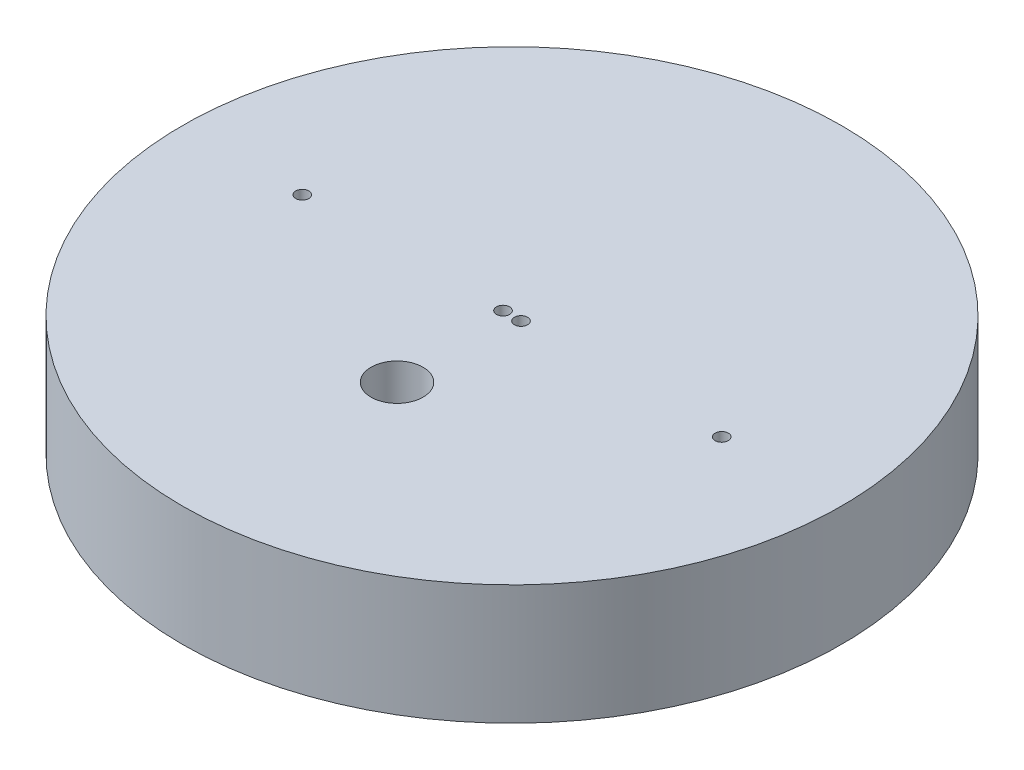
from build123d import *

# Parameters (mm, degrees)
SKETCH16_W           = 60
SKETCH16_H           = 60
BOSS_EXTRUDE7_DEPTH  = 10
REVOLVE3_ANGLE       = 180
SKETCH18_R           = 1.75
CUT_EXTRUDE1_DEPTH   = 20.5
SKETCH24_R           = 0.55
CUT_EXTRUDE3_DEPTH   = 47
SKETCH35_W           = 37.108936952
SKETCH35_H           = 20.335438399
CUT_EXTRUDE7_DEPTH   = 66
SKETCH40_R           = 15
CUT_EXTRUDE8_DEPTH   = 3
SKETCH41_R           = 15
CUT_EXTRUDE9_DEPTH   = 13
BOSS_EXTRUDE10_START = -10
SKETCH44_R           = 27.5
SKETCH44_R_2         = 25
BOSS_EXTRUDE10_DEPTH = 10
SKETCH45_W           = 60
SKETCH45_H           = 60
SKETCH45_R           = 27.5
CUT_EXTRUDE10_DEPTH  = 10
SKETCH46_R           = 2.5
BOSS_EXTRUDE11_DEPTH = 4
SKETCH47_R           = 2.170581875
CUT_EXTRUDE11_DEPTH  = 41.416580756
SKETCH48_R           = 0.55
CUT_EXTRUDE12_DEPTH  = 41.416580756
SKETCH49_R           = 27.5
CUT_EXTRUDE13_DEPTH  = 10


with BuildPart() as part:
    # Sketch16 → Boss-Extrude7 (new body)
    with BuildSketch(Plane(origin=(0, 57.950548418, 0), x_dir=(1, 0, 0), z_dir=(0, 1, 0))):
        Rectangle(SKETCH16_W, SKETCH16_H)
    extrude(amount=BOSS_EXTRUDE7_DEPTH)

    # Sketch17 → Revolve3 (revolve)
    with BuildSketch(Plane.XZ.offset(-57.950548418)):
        with BuildLine():
            Line((0, 15), (0, -15))
            ThreePointArc((0, -15), (15, 0), (0, 15))
        make_face()
    revolve(axis=Axis((0, 57.950548418, 15), (0, 0, -1)), revolution_arc=REVOLVE3_ANGLE)

    # Sketch18 → Cut-Extrude1 (cut, symmetric)
    with BuildSketch(Plane.XZ.offset(-57.950548418)):
        with Locations((-20, 20)):
            Circle(SKETCH18_R)
        with Locations((20, 20)):
            Circle(SKETCH18_R)
        with Locations((-20, -20)):
            Circle(SKETCH18_R)
        with Locations((20, -20)):
            Circle(SKETCH18_R)
    extrude(amount=CUT_EXTRUDE1_DEPTH, both=True, mode=Mode.SUBTRACT)

    # Sketch24 → Cut-Extrude3 (cut)
    with BuildSketch(Plane(origin=(0, 67.950548418, 0), x_dir=(1, 0, 0), z_dir=(0, 1, 0))):
        with Locations((-17.5, 0)):
            Circle(SKETCH24_R)
        with Locations((17.5, 0)):
            Circle(SKETCH24_R)
    extrude(amount=-CUT_EXTRUDE3_DEPTH, mode=Mode.SUBTRACT)

    # Sketch35 → Cut-Extrude7 (cut)
    with BuildSketch(Plane(origin=(0, 0, -30), x_dir=(-1, 0, 0), z_dir=(0, 0, -1))):
        with Locations((-0.194287628, 37.782829219)):
            Rectangle(SKETCH35_W, SKETCH35_H)
    extrude(amount=-CUT_EXTRUDE7_DEPTH, mode=Mode.SUBTRACT)

    # Sketch40 → Cut-Extrude8 (cut)
    with BuildSketch(Plane(origin=(0, 57.950548418, 0), x_dir=(-1, 0, 0), z_dir=(0, -1, 0))):
        with BuildLine():
            ThreePointArc((-24.875, -2.496873044), (-17.67766953, -17.67766953), (-2.496873044, -24.875))
            ThreePointArc((-2.496873044, -24.875), (0, -22.5), (2.496873044, -24.875))
            ThreePointArc((2.496873044, -24.875), (17.67766953, -17.67766953), (24.875, -2.496873044))
            ThreePointArc((24.875, -2.496873044), (22.5, 0), (24.875, 2.496873044))
            ThreePointArc((24.875, 2.496873044), (17.67766953, 17.67766953), (2.496873044, 24.875))
            ThreePointArc((2.496873044, 24.875), (0, 22.5), (-2.496873044, 24.875))
            ThreePointArc((-2.496873044, 24.875), (-17.67766953, 17.67766953), (-24.875, 2.496873044))
            ThreePointArc((-24.875, 2.496873044), (-22.5, 0), (-24.875, -2.496873044))
        make_face()
        Circle(SKETCH40_R, mode=Mode.SUBTRACT)
    extrude(amount=-CUT_EXTRUDE8_DEPTH, mode=Mode.SUBTRACT)

    # Sketch41 → Cut-Extrude9 (cut)
    with BuildSketch(Plane.XZ.offset(-47.950548418)):
        Circle(SKETCH41_R)
    extrude(amount=-CUT_EXTRUDE9_DEPTH, mode=Mode.SUBTRACT)

    # Sketch44 → Boss-Extrude10 (add)
    with BuildSketch(Plane(origin=(0, 67.950548418, 0), x_dir=(1, 0, 0), z_dir=(0, 1, 0)).offset(BOSS_EXTRUDE10_START)):
        Circle(SKETCH44_R)
        Circle(SKETCH44_R_2, mode=Mode.SUBTRACT)
    extrude(amount=BOSS_EXTRUDE10_DEPTH)

    # Sketch45 → Cut-Extrude10 (cut)
    with BuildSketch(Plane(origin=(0, 57.950548418, 0), x_dir=(-1, 0, 0), z_dir=(0, -1, 0))):
        Rectangle(SKETCH45_W, SKETCH45_H)
        Circle(SKETCH45_R, mode=Mode.SUBTRACT)
    extrude(amount=-CUT_EXTRUDE10_DEPTH, mode=Mode.SUBTRACT)

    # Sketch46 → Boss-Extrude11 (add)
    with BuildSketch(Plane(origin=(0, 67.950548418, 0), x_dir=(1, 0, 0), z_dir=(0, 1, 0))):
        with Locations((0, 25)):
            Circle(SKETCH46_R)
        with Locations((-25, 0)):
            Circle(SKETCH46_R)
        with Locations((25, 0)):
            Circle(SKETCH46_R)
        with Locations((0, -25)):
            Circle(SKETCH46_R)
    extrude(amount=BOSS_EXTRUDE11_DEPTH)

    # Sketch47 → Cut-Extrude11 (cut, through all)
    with BuildSketch(Plane(origin=(0, 60.950548418, 0), x_dir=(-1, 0, 0), z_dir=(0, -1, 0))):
        with Locations((0, -9.593971887)):
            Circle(SKETCH47_R)
    extrude(amount=-CUT_EXTRUDE11_DEPTH, mode=Mode.SUBTRACT)

    # Sketch48 → Cut-Extrude12 (cut, through all)
    with BuildSketch(Plane(origin=(0, 60.950548418, 0), x_dir=(-1, 0, 0), z_dir=(0, -1, 0))):
        with Locations((0.75, 0)):
            Circle(SKETCH48_R)
        with Locations((-0.75, 0)):
            Circle(SKETCH48_R)
    extrude(amount=-CUT_EXTRUDE12_DEPTH, mode=Mode.SUBTRACT)

    # Sketch49 → Cut-Extrude13 (cut)
    with BuildSketch(Plane(origin=(0, 67.950548418, 0), x_dir=(1, 0, 0), z_dir=(0, 1, 0))):
        Circle(SKETCH49_R)
    extrude(amount=CUT_EXTRUDE13_DEPTH, mode=Mode.SUBTRACT)


solid = part.part
